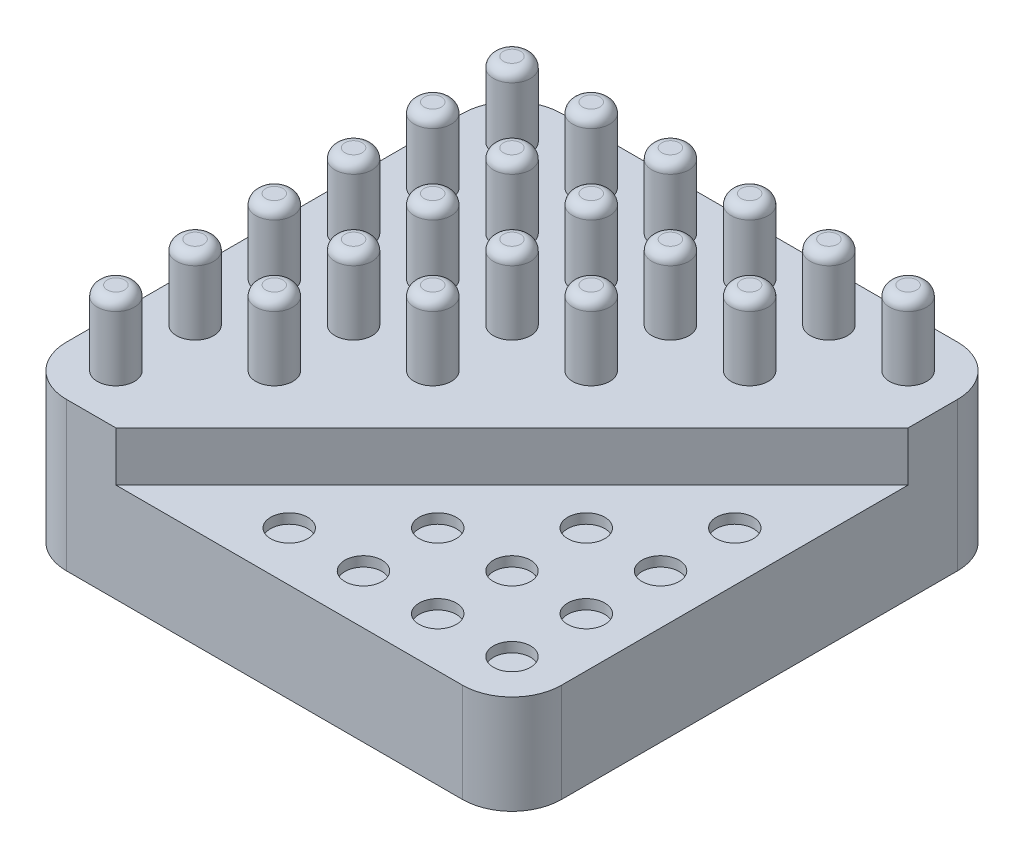
from build123d import *

# Parameters (mm, degrees)
BOSS_EXTRUDE1_DEPTH = 30
BOSS_EXTRUDE3_DEPTH = 15
FILLET3_R           = 2
CUT_EXTRUDE3_DEPTH  = 10
SKETCH17_R          = 3.750000000000006
SKETCH17_R_2        = 3.7500000000000058
SKETCH17_R_3        = 3.750000000000007
CUT_EXTRUDE4_DEPTH  = 2


# Read off the part's stored shape, not the designer's step: CrvPattern8
with BuildPart() as part:
    # Sketch1 → Boss-Extrude1 (new body)
    with BuildSketch(Plane(origin=(0, 0, 0), x_dir=(1, 0, 0), z_dir=(0, 1, 0))):
        with BuildLine():
            ThreePointArc((0, 10), (2.9289321881345227, 2.9289321881345227), (10, 0))
            Line((10, 0), (90.00000000000001, 0))
            ThreePointArc((90.00000000000001, -5.33e-15), (97.07106781186549, 2.9289321881345227), (100, 10.000000000000002))
            Line((100, 10.000000000000002), (100, 90.00000000000001))
            ThreePointArc((100, 90.00000000000001), (97.07106781186548, 97.07106781186548), (90.00000000000001, 100))
            Line((90.00000000000001, 100), (10, 100))
            ThreePointArc((10, 100), (2.928932188134536, 97.07106781186548), (-3.55e-15, 90.00000000000001))
            Line((0, 90.00000000000001), (0, 10))
        make_face()
    extrude(amount=BOSS_EXTRUDE1_DEPTH)

    # Sketch13 → Boss-Extrude3 (add)
    with BuildSketch(Plane(origin=(0, 30, 0), x_dir=(1, 0, 0), z_dir=(0, 1, 0))):
        with BuildLine():
            Line((13.749999999999968, 89.99999999999994), (9.999999999999968, 89.99999999999994))
            Line((9.999999999999968, 89.99999999999994), (9.999999999999968, 86.24999999999994))
            ThreePointArc((10.000000000000053, 86.24999999999994), (12.651650429449552, 87.34834957055043), (13.749999999999968, 89.99999999999994))
        make_face()
        with BuildLine():
            Line((9.999999999999968, 93.74999999999994), (9.999999999999968, 89.99999999999994))
            Line((9.999999999999968, 89.99999999999994), (13.749999999999968, 89.99999999999994))
            ThreePointArc((13.749999999999968, 89.99999999999994), (12.651650429449552, 92.65165042944946), (10.000000000000055, 93.74999999999994))
        make_face()
        with BuildLine():
            ThreePointArc((10.000000000000055, 93.74999999999994), (7.348349570550445, 92.65165042944953), (6.249999999999968, 89.99999999999994))
            Line((6.249999999999968, 89.99999999999994), (9.999999999999968, 89.99999999999994))
            Line((9.999999999999968, 89.99999999999994), (9.999999999999968, 93.74999999999994))
        make_face()
        with BuildLine():
            Line((9.999999999999968, 89.99999999999994), (6.249999999999968, 89.99999999999994))
            ThreePointArc((6.249999999999968, 89.99999999999994), (7.348349570550445, 87.34834957055035), (10.000000000000053, 86.24999999999994))
            Line((9.999999999999968, 86.24999999999994), (9.999999999999968, 89.99999999999994))
        make_face()
    extrude(amount=BOSS_EXTRUDE3_DEPTH)

    # Fillet3
    fillet3_edges = [part.edges().sort_by_distance(p)[0] for p in [
        (13.749999999999947, 45, -89.99999999999997),
    ]]
    fillet(fillet3_edges, radius=FILLET3_R)

    # CrvPattern8 outline → CrvPattern8 (revolve)
    with BuildSketch(Plane(origin=(10, 0, -74), x_dir=(1, 0, 0), z_dir=(0, 0, 1))):
        with BuildLine():
            Line((1.75, 45), (0, 45))
            Line((0, 45), (0, 30))
            Line((0, 30), (3.75, 30))
            Line((3.75, 30), (3.75, 43))
            ThreePointArc((3.75, 43), (3.164213562, 44.414213562), (1.75, 45))
        make_face()
    revolve(axis=Axis((10, 0, -74), (0, 1, 0)))

    # CrvPattern8 2 outline → CrvPattern8 2 (revolve)
    with BuildSketch(Plane(origin=(10, 0, -58), x_dir=(1, 0, 0), z_dir=(0, 0, 1))):
        with BuildLine():
            Line((1.75, 45), (0, 45))
            Line((0, 45), (0, 30))
            Line((0, 30), (3.75, 30))
            Line((3.75, 30), (3.75, 43))
            ThreePointArc((3.75, 43), (3.164213562, 44.414213562), (1.75, 45))
        make_face()
    revolve(axis=Axis((10, 0, -58), (0, 1, 0)))

    # CrvPattern8 3 outline → CrvPattern8 3 (revolve)
    with BuildSketch(Plane(origin=(10, 0, -42), x_dir=(1, 0, 0), z_dir=(0, 0, 1))):
        with BuildLine():
            Line((1.75, 45), (0, 45))
            Line((0, 45), (0, 30))
            Line((0, 30), (3.75, 30))
            Line((3.75, 30), (3.75, 43))
            ThreePointArc((3.75, 43), (3.164213562, 44.414213562), (1.75, 45))
        make_face()
    revolve(axis=Axis((10, 0, -42), (0, 1, 0)))

    # CrvPattern8 4 outline → CrvPattern8 4 (revolve)
    with BuildSketch(Plane(origin=(10, 0, -26), x_dir=(1, 0, 0), z_dir=(0, 0, 1))):
        with BuildLine():
            Line((1.75, 45), (0, 45))
            Line((0, 45), (0, 30))
            Line((0, 30), (3.75, 30))
            Line((3.75, 30), (3.75, 43))
            ThreePointArc((3.75, 43), (3.164213562, 44.414213562), (1.75, 45))
        make_face()
    revolve(axis=Axis((10, 0, -26), (0, 1, 0)))

    # CrvPattern8 5 outline → CrvPattern8 5 (revolve)
    with BuildSketch(Plane(origin=(10, 0, -10), x_dir=(1, 0, 0), z_dir=(0, 0, 1))):
        with BuildLine():
            Line((1.75, 45), (0, 45))
            Line((0, 45), (0, 30))
            Line((0, 30), (3.75, 30))
            Line((3.75, 30), (3.75, 43))
            ThreePointArc((3.75, 43), (3.164213562, 44.414213562), (1.75, 45))
        make_face()
    revolve(axis=Axis((10, 0, -10), (0, 1, 0)))

    # CrvPattern8 6 outline → CrvPattern8 6 (revolve)
    with BuildSketch(Plane(origin=(26, 0, -90), x_dir=(1, 0, 0), z_dir=(0, 0, 1))):
        with BuildLine():
            Line((1.75, 45), (0, 45))
            Line((0, 45), (0, 30))
            Line((0, 30), (3.75, 30))
            Line((3.75, 30), (3.75, 43))
            ThreePointArc((3.75, 43), (3.164213562, 44.414213562), (1.75, 45))
        make_face()
    revolve(axis=Axis((26, 0, -90), (0, 1, 0)))

    # CrvPattern8 7 outline → CrvPattern8 7 (revolve)
    with BuildSketch(Plane(origin=(26, 0, -74), x_dir=(1, 0, 0), z_dir=(0, 0, 1))):
        with BuildLine():
            Line((1.75, 45), (0, 45))
            Line((0, 45), (0, 30))
            Line((0, 30), (3.75, 30))
            Line((3.75, 30), (3.75, 43))
            ThreePointArc((3.75, 43), (3.164213562, 44.414213562), (1.75, 45))
        make_face()
    revolve(axis=Axis((26, 0, -74), (0, 1, 0)))

    # CrvPattern8 8 outline → CrvPattern8 8 (revolve)
    with BuildSketch(Plane(origin=(26, 0, -58), x_dir=(1, 0, 0), z_dir=(0, 0, 1))):
        with BuildLine():
            Line((1.75, 45), (0, 45))
            Line((0, 45), (0, 30))
            Line((0, 30), (3.75, 30))
            Line((3.75, 30), (3.75, 43))
            ThreePointArc((3.75, 43), (3.164213562, 44.414213562), (1.75, 45))
        make_face()
    revolve(axis=Axis((26, 0, -58), (0, 1, 0)))

    # CrvPattern8 9 outline → CrvPattern8 9 (revolve)
    with BuildSketch(Plane(origin=(26, 0, -42), x_dir=(1, 0, 0), z_dir=(0, 0, 1))):
        with BuildLine():
            Line((1.75, 45), (0, 45))
            Line((0, 45), (0, 30))
            Line((0, 30), (3.75, 30))
            Line((3.75, 30), (3.75, 43))
            ThreePointArc((3.75, 43), (3.164213562, 44.414213562), (1.75, 45))
        make_face()
    revolve(axis=Axis((26, 0, -42), (0, 1, 0)))

    # CrvPattern8 10 outline → CrvPattern8 10 (revolve)
    with BuildSketch(Plane(origin=(26, 0, -26), x_dir=(1, 0, 0), z_dir=(0, 0, 1))):
        with BuildLine():
            Line((1.75, 45), (0, 45))
            Line((0, 45), (0, 30))
            Line((0, 30), (3.75, 30))
            Line((3.75, 30), (3.75, 43))
            ThreePointArc((3.75, 43), (3.164213562, 44.414213562), (1.75, 45))
        make_face()
    revolve(axis=Axis((26, 0, -26), (0, 1, 0)))

    # CrvPattern8 11 outline → CrvPattern8 11 (revolve)
    with BuildSketch(Plane(origin=(42, 0, -90), x_dir=(1, 0, 0), z_dir=(0, 0, 1))):
        with BuildLine():
            Line((1.75, 45), (0, 45))
            Line((0, 45), (0, 30))
            Line((0, 30), (3.75, 30))
            Line((3.75, 30), (3.75, 43))
            ThreePointArc((3.75, 43), (3.164213562, 44.414213562), (1.75, 45))
        make_face()
    revolve(axis=Axis((42, 0, -90), (0, 1, 0)))

    # CrvPattern8 12 outline → CrvPattern8 12 (revolve)
    with BuildSketch(Plane(origin=(42, 0, -74), x_dir=(1, 0, 0), z_dir=(0, 0, 1))):
        with BuildLine():
            Line((1.75, 45), (0, 45))
            Line((0, 45), (0, 30))
            Line((0, 30), (3.75, 30))
            Line((3.75, 30), (3.75, 43))
            ThreePointArc((3.75, 43), (3.164213562, 44.414213562), (1.75, 45))
        make_face()
    revolve(axis=Axis((42, 0, -74), (0, 1, 0)))

    # CrvPattern8 13 outline → CrvPattern8 13 (revolve)
    with BuildSketch(Plane(origin=(42, 0, -58), x_dir=(1, 0, 0), z_dir=(0, 0, 1))):
        with BuildLine():
            Line((1.75, 45), (0, 45))
            Line((0, 45), (0, 30))
            Line((0, 30), (3.75, 30))
            Line((3.75, 30), (3.75, 43))
            ThreePointArc((3.75, 43), (3.164213562, 44.414213562), (1.75, 45))
        make_face()
    revolve(axis=Axis((42, 0, -58), (0, 1, 0)))

    # CrvPattern8 14 outline → CrvPattern8 14 (revolve)
    with BuildSketch(Plane(origin=(42, 0, -42), x_dir=(1, 0, 0), z_dir=(0, 0, 1))):
        with BuildLine():
            Line((1.75, 45), (0, 45))
            Line((0, 45), (0, 30))
            Line((0, 30), (3.75, 30))
            Line((3.75, 30), (3.75, 43))
            ThreePointArc((3.75, 43), (3.164213562, 44.414213562), (1.75, 45))
        make_face()
    revolve(axis=Axis((42, 0, -42), (0, 1, 0)))

    # CrvPattern8 15 outline → CrvPattern8 15 (revolve)
    with BuildSketch(Plane(origin=(58, 0, -90), x_dir=(1, 0, 0), z_dir=(0, 0, 1))):
        with BuildLine():
            Line((1.75, 45), (0, 45))
            Line((0, 45), (0, 30))
            Line((0, 30), (3.75, 30))
            Line((3.75, 30), (3.75, 43))
            ThreePointArc((3.75, 43), (3.164213562, 44.414213562), (1.75, 45))
        make_face()
    revolve(axis=Axis((58, 0, -90), (0, 1, 0)))

    # CrvPattern8 16 outline → CrvPattern8 16 (revolve)
    with BuildSketch(Plane(origin=(58, 0, -74), x_dir=(1, 0, 0), z_dir=(0, 0, 1))):
        with BuildLine():
            Line((1.75, 45), (0, 45))
            Line((0, 45), (0, 30))
            Line((0, 30), (3.75, 30))
            Line((3.75, 30), (3.75, 43))
            ThreePointArc((3.75, 43), (3.164213562, 44.414213562), (1.75, 45))
        make_face()
    revolve(axis=Axis((58, 0, -74), (0, 1, 0)))

    # CrvPattern8 17 outline → CrvPattern8 17 (revolve)
    with BuildSketch(Plane(origin=(58, 0, -58), x_dir=(1, 0, 0), z_dir=(0, 0, 1))):
        with BuildLine():
            Line((1.75, 45), (0, 45))
            Line((0, 45), (0, 30))
            Line((0, 30), (3.75, 30))
            Line((3.75, 30), (3.75, 43))
            ThreePointArc((3.75, 43), (3.164213562, 44.414213562), (1.75, 45))
        make_face()
    revolve(axis=Axis((58, 0, -58), (0, 1, 0)))

    # CrvPattern8 18 outline → CrvPattern8 18 (revolve)
    with BuildSketch(Plane(origin=(74, 0, -90), x_dir=(1, 0, 0), z_dir=(0, 0, 1))):
        with BuildLine():
            Line((1.75, 45), (0, 45))
            Line((0, 45), (0, 30))
            Line((0, 30), (3.75, 30))
            Line((3.75, 30), (3.75, 43))
            ThreePointArc((3.75, 43), (3.164213562, 44.414213562), (1.75, 45))
        make_face()
    revolve(axis=Axis((74, 0, -90), (0, 1, 0)))

    # CrvPattern8 19 outline → CrvPattern8 19 (revolve)
    with BuildSketch(Plane(origin=(74, 0, -74), x_dir=(1, 0, 0), z_dir=(0, 0, 1))):
        with BuildLine():
            Line((1.75, 45), (0, 45))
            Line((0, 45), (0, 30))
            Line((0, 30), (3.75, 30))
            Line((3.75, 30), (3.75, 43))
            ThreePointArc((3.75, 43), (3.164213562, 44.414213562), (1.75, 45))
        make_face()
    revolve(axis=Axis((74, 0, -74), (0, 1, 0)))

    # CrvPattern8 20 outline → CrvPattern8 20 (revolve)
    with BuildSketch(Plane(origin=(90, 0, -90), x_dir=(1, 0, 0), z_dir=(0, 0, 1))):
        with BuildLine():
            Line((1.75, 45), (0, 45))
            Line((0, 45), (0, 30))
            Line((0, 30), (3.75, 30))
            Line((3.75, 30), (3.75, 43))
            ThreePointArc((3.75, 43), (3.164213562, 44.414213562), (1.75, 45))
        make_face()
    revolve(axis=Axis((90, 0, -90), (0, 1, 0)))

    # Sketch14 → Cut-Extrude3 (cut)
    with BuildSketch(Plane(origin=(0, 30, 0), x_dir=(1, 0, 0), z_dir=(0, 1, 0))):
        Polygon((100, 80), (20.000000000000004, -9.8e-15), (100, 0), align=None)
    extrude(amount=-CUT_EXTRUDE3_DEPTH, mode=Mode.SUBTRACT)

    # Sketch17 → Cut-Extrude4 (cut)
    with BuildSketch(Plane(origin=(0, 19.999999999999996, 0), x_dir=(1, 0, 0), z_dir=(0, 1, 0))):
        with Locations(Location((90.00000000000013, 10.000000000000002, 0), (0, 0, 270))):
            Circle(SKETCH17_R)
        with Locations(Location((44.9999999999999, 9.999999999999996, 0), (0, 0, 270))):
            Circle(SKETCH17_R)
        with Locations(Location((59.9999999999999, 10, 0), (0, 0, 270))):
            Circle(SKETCH17_R)
        with Locations(Location((75.00000000000001, 10, 0), (0, 0, 270))):
            Circle(SKETCH17_R)
        with Locations(Location((90.00000000000001, 25, 0), (0, 0, 270))):
            Circle(SKETCH17_R_2)
        with Locations(Location((74.9999999999999, 25, 0), (0, 0, 270))):
            Circle(SKETCH17_R_2)
        with Locations(Location((59.9999999999999, 24.999999999999996, 0), (0, 0, 270))):
            Circle(SKETCH17_R_2)
        with Locations(Location((74.9999999999999, 39.99999999999999, 0), (0, 0, 270))):
            Circle(SKETCH17_R_3)
        with Locations(Location((90.00000000000001, 39.99999999999999, 0), (0, 0, 270))):
            Circle(SKETCH17_R_3)
        with Locations(Location((90.00000000000001, 54.99999999999999, 0), (0, 0, 270))):
            Circle(SKETCH17_R_3)
    extrude(amount=-CUT_EXTRUDE4_DEPTH, mode=Mode.SUBTRACT)


solid = part.part
